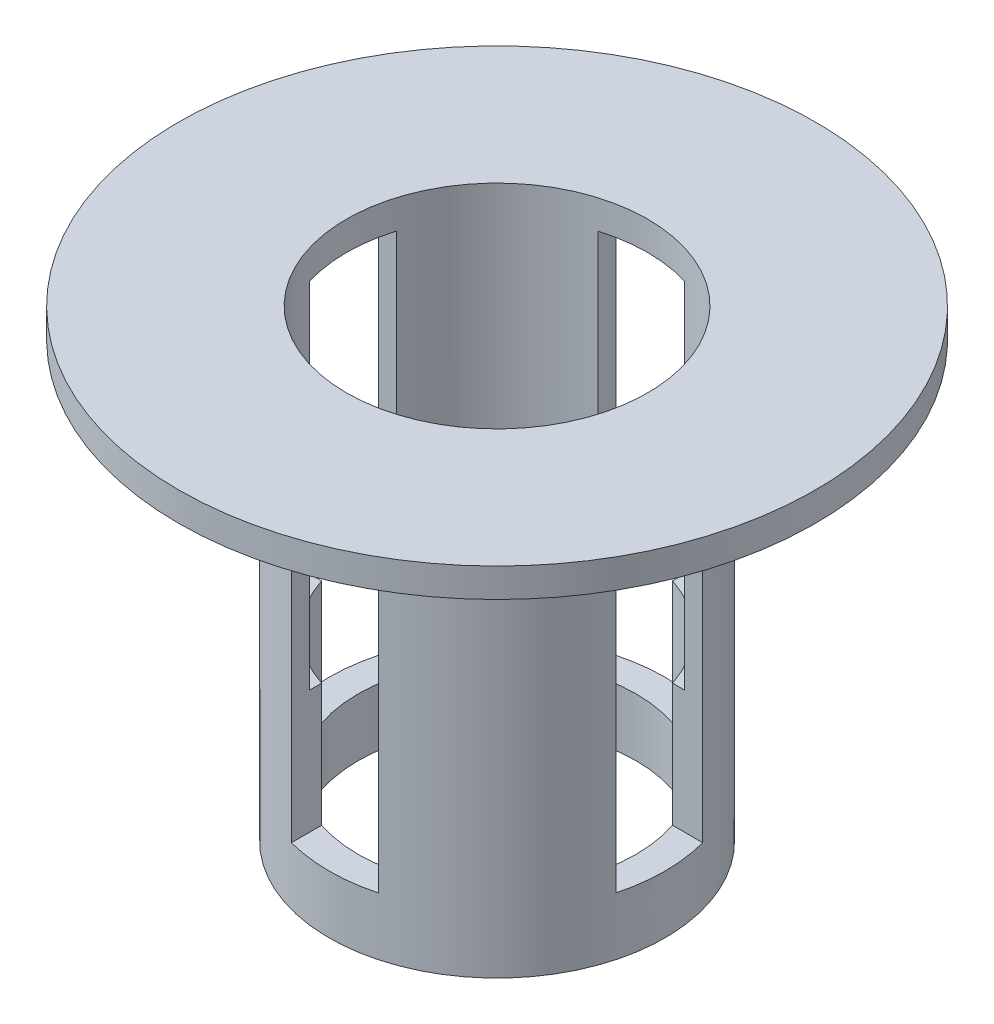
from build123d import *
from build123d.topology import SkipClean

# Parameters (mm, degrees)
SKETCH1_R          = 13.97
SKETCH1_R_2        = 6.604
STABILIZER_DEPTH   = 1.27
LARGE_START        = 11.1125
SKETCH2_R          = 7.366
SKETCH2_R_2        = 6.604
LARGE_END_DEPTH    = 11.1125
SMALL_START        = 7.9375
SKETCH3_R          = 7.366
SKETCH3_R_2        = 6.096
SMALL_END_DEPTH    = 7.9375
SKETCH5_W          = 3.81
SKETCH5_H          = 16.51
CUT_EXTRUDE1_DEPTH = 33.608100159
SKETCH7_W          = 3.81
SKETCH7_H          = 16.51
CUT_EXTRUDE2_DEPTH = 33.608100159


with BuildPart() as part:
    # Sketch1 → Stabilizer (new body)
    with BuildSketch(Plane(origin=(0, 0, 0), x_dir=(1, 0, 0), z_dir=(0, 1, 0))):
        Circle(SKETCH1_R)
        Circle(SKETCH1_R_2, mode=Mode.SUBTRACT)
    extrude(amount=STABILIZER_DEPTH)

    # Sketch2 → Large End (add)
    with SkipClean():  # the faces are left unmerged after this step: merging them gives an invalid solid
        with BuildSketch(Plane(origin=(0, 0, 0), x_dir=(-1, 0, 0), z_dir=(0, -1, 0)).offset(LARGE_START)):
            Circle(SKETCH2_R)
            Circle(SKETCH2_R_2, mode=Mode.SUBTRACT)
        extrude(amount=-LARGE_END_DEPTH)

    # Sketch3 → Small End (add)
    with SkipClean():  # the faces are left unmerged after this step: merging them gives an invalid solid
        with BuildSketch(Plane(origin=(0, -11.1125, 0), x_dir=(-1, 0, 0), z_dir=(0, -1, 0)).offset(SMALL_START)):
            Circle(SKETCH3_R)
            Circle(SKETCH3_R_2, mode=Mode.SUBTRACT)
        extrude(amount=-SMALL_END_DEPTH)

    # Sketch5 → Cut-Extrude1 (cut, through all)
    with SkipClean():  # the faces are left unmerged after this step: merging them gives an invalid solid
        with BuildSketch(Plane(origin=(0, -19.05, 7.366), x_dir=(1, 0, 0), z_dir=(0, 0, 1))):
            with Locations((0, 10.795)):
                Rectangle(SKETCH5_W, SKETCH5_H)
        extrude(amount=-CUT_EXTRUDE1_DEPTH, mode=Mode.SUBTRACT)

    # Sketch7 → Cut-Extrude2 (cut, through all)
    with SkipClean():  # the faces are left unmerged after this step: merging them gives an invalid solid
        with BuildSketch(Plane(origin=(7.366, -19.05, 0), x_dir=(0, 0, -1), z_dir=(1, 0, 0))):
            with Locations((0, 10.795)):
                Rectangle(SKETCH7_W, SKETCH7_H)
        extrude(amount=-CUT_EXTRUDE2_DEPTH, mode=Mode.SUBTRACT)
    add(part.part.scale(1), mode=Mode.REPLACE)  # the faces are merged on a copy


solid = part.part
